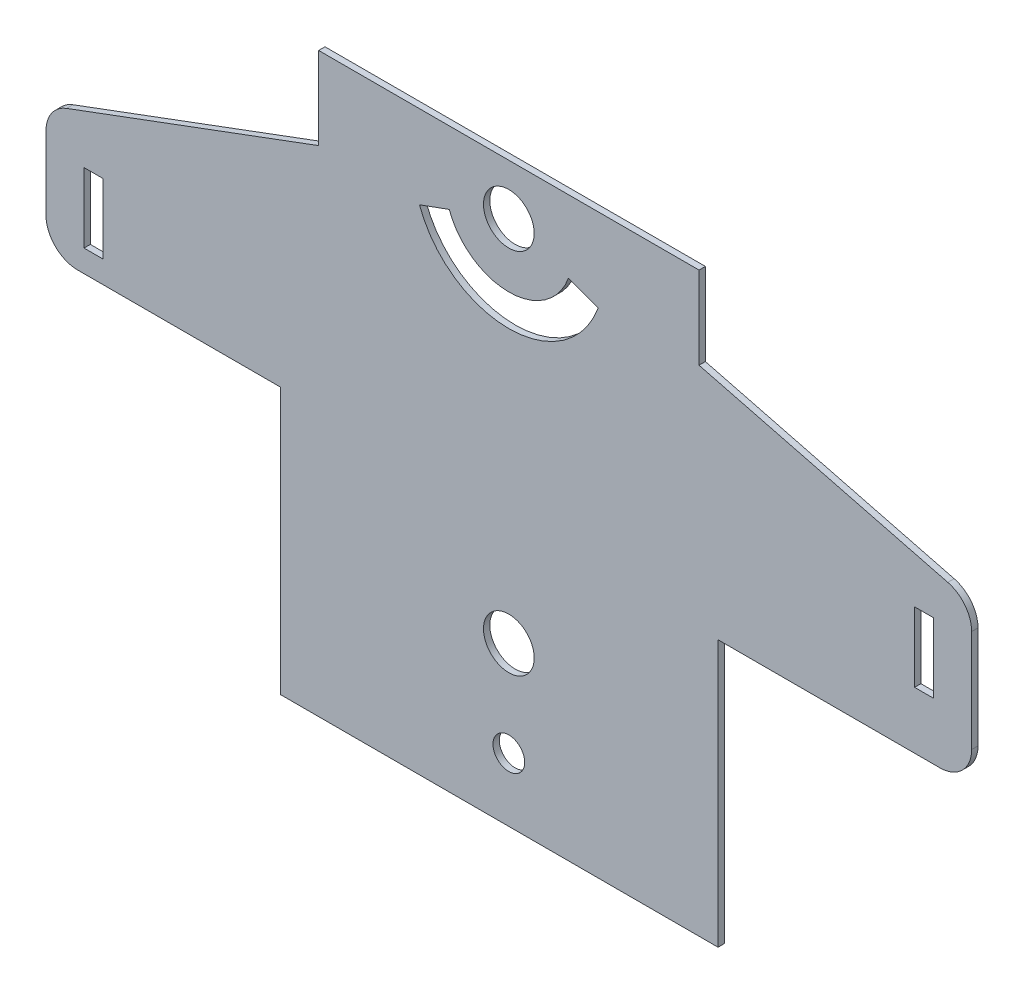
from build123d import *

# Parameters (mm, degrees)
SKETCH1_W                    = 68
SKETCH1_H                    = 42
BOSS_EXTRUDE1_DEPTH          = 1
SKETCH3_W                    = 1
SKETCH3_H                    = 42
EXTRUDE_THIN1_DEPTH          = 20
SKETCH4_R                    = 5
CUT_EXTRUDE1_DEPTH           = 144.394560566
SKETCH6_W                    = 3
SKETCH6_H                    = 11
CUT_EXTRUDE2_DEPTH           = 143.779550356
SKETCH6_3_R                  = 4
BOSS_EXTRUDE2_DEPTH          = 15
SKETCH6_4_R                  = 2.5
SKETCH6_4_R_2                = 4
BOSS_EXTRUDE3_DEPTH          = 6
SKETCH7_W                    = 1
SKETCH7_H                    = 42
BOSS_EXTRUDE5_DEPTH          = 1
FILLET2_R                    = 5
SKETCH8_W                    = 60
SKETCH8_H                    = 1
BOSS_EXTRUDE6_DEPTH          = 20
CONVERT_SOLID1_START         = -20
CONVERT_SOLID1_OUTLINE_W     = 1
CONVERT_SOLID1_OUTLINE_H     = 42
CONVERT_SOLID1_OUTLINE_W_2   = 60
CONVERT_SOLID1_OUTLINE_H_2   = 1
CONVERT_SOLID1_DEPTH         = 20
CONVERT_SOLID1_2_OUTLINE_R   = 2.5
CONVERT_SOLID1_2_OUTLINE_R_2 = 4
CONVERT_SOLID1_2_DEPTH       = 16


# Read off the part's stored shape, not the designer's step: Convert-Solid1
with BuildPart() as part:
    # Sketch1 → Boss-Extrude1 (new body)
    with BuildSketch(Plane.XY):
        Polygon((-38, 62), (-38, 42), (0, 42), (68, 42), (108, 42), (108, 67), (65, 78), (65, 91), (5, 91), (5, 78), align=None)
        with Locations((34, 21)):
            Rectangle(SKETCH1_W, SKETCH1_H)
    extrude(amount=BOSS_EXTRUDE1_DEPTH)

    # Sketch3 → Extrude-Thin1 (add)
    with BuildSketch(Plane(origin=(0, 0, 0), x_dir=(-1, 0, 0), z_dir=(0, 0, -1))):
        with Locations((0.5, 21)):
            Rectangle(SKETCH3_W, SKETCH3_H)
        with Locations((-67.5, 21)):
            Rectangle(SKETCH3_W, SKETCH3_H)
    extrude(amount=EXTRUDE_THIN1_DEPTH)


with BuildPart() as extrude_thin1_piece_1:
    # of the separate pieces the step leaves, piece 1, a body of its own (extrude_thin1_pieces)
    add(part.part.solids().sort_by_distance((-38, 62, 0))[0])


with BuildPart() as extrude_thin1_piece_2:
    # of the separate pieces the step leaves, piece 2, a body of its own (extrude_thin1_pieces)
    add(part.part.solids().sort_by_distance((0, 42, -20))[0])


with BuildPart() as cut_extrude1_tool:
    # Sketch4 → Cut-Extrude1 (new, through all)
    with BuildSketch(Plane.ZY.offset(1)):
        with Locations((-9.5, 15)):
            Circle(SKETCH4_R)
    extrude(amount=-CUT_EXTRUDE1_DEPTH)


with BuildPart() as extrude_thin1_piece_1_1:
    add(extrude_thin1_piece_1.part)

    # Cut-Extrude1: cut by cut_extrude1_tool
    add(cut_extrude1_tool.part, mode=Mode.SUBTRACT)

    # Sketch6 → Cut-Extrude2 (cut, through all)
    with BuildSketch(Plane.XY.offset(1)):
        with Locations((100.5, 56.5)):
            Rectangle(SKETCH6_W, SKETCH6_H)
        with Locations((-30.5, 51)):
            Rectangle(SKETCH6_W, SKETCH6_H)
        with BuildLine():
            Line((49.095389312, 77.86969785), (44.396926208, 79.579798567))
            ThreePointArc((44.396926208, 79.579798567), (35, 73), (25.603073792, 79.579798567))
            Line((25.603073792, 79.579798567), (20.904610688, 77.86969785))
            ThreePointArc((20.904610688, 77.86969785), (35, 68), (49.095389312, 77.86969785))
        make_face()
    extrude(amount=-CUT_EXTRUDE2_DEPTH, mode=Mode.SUBTRACT)

    # Sketch6<3> → Boss-Extrude2 (add)
    with BuildSketch(Plane.XY.offset(1)):
        with Locations((35, 83)):
            Circle(SKETCH6_3_R)
    extrude(amount=BOSS_EXTRUDE2_DEPTH)

    # Sketch6<4> → Boss-Extrude3 (add)
    with BuildSketch(Plane.XY.offset(1)):
        with Locations((35, 10)):
            Circle(SKETCH6_4_R)
        with Locations((35, 25)):
            Circle(SKETCH6_4_R_2)
    extrude(amount=BOSS_EXTRUDE3_DEPTH)



with BuildPart() as extrude_thin1_piece_2_1:
    add(extrude_thin1_piece_2.part)

    # Cut-Extrude1: cut by cut_extrude1_tool
    add(cut_extrude1_tool.part, mode=Mode.SUBTRACT)


with BuildPart() as extrude_thin1_piece_1_2:
    add(extrude_thin1_piece_1_1.part)

    add(extrude_thin1_piece_2_1.part)  # Boss-Extrude5 merges Extrude-Thin1 piece 2
    # Sketch7 → Boss-Extrude5 (add)
    with BuildSketch(Plane.XY):
        with Locations((-0.5, 21)):
            Rectangle(SKETCH7_W, SKETCH7_H)
    extrude(amount=BOSS_EXTRUDE5_DEPTH)

    # Fillet2
    fillet2_edges = [extrude_thin1_piece_1_2.edges().sort_by_distance(p)[0] for p in [
        (-0.5, 0, -20),
        (-38, 42, 0.5),
        (-38, 62, 0.5),
        (67.5, 0, -20),
        (108, 42, 0.5),
        (108, 67, 0.5),
        (67.5, 42, -20),
        (-0.5, 42, -20),
    ]]
    fillet(fillet2_edges, radius=FILLET2_R)

    # Sketch8 → Boss-Extrude6 (add)
    with BuildSketch(Plane(origin=(0, 0, 0), x_dir=(-1, 0, 0), z_dir=(0, 0, -1))):
        with Locations((-35, 90.5)):
            Rectangle(SKETCH8_W, SKETCH8_H)
    extrude(amount=BOSS_EXTRUDE6_DEPTH)

    # Convert-Solid1 outline → Convert-Solid1 (cut)
    with BuildSketch(Plane.XY.offset(CONVERT_SOLID1_START)):
        with Locations((-0.5, 21)):
            Rectangle(CONVERT_SOLID1_OUTLINE_W, CONVERT_SOLID1_OUTLINE_H)
        with Locations((67.5, 21)):
            Rectangle(CONVERT_SOLID1_OUTLINE_W, CONVERT_SOLID1_OUTLINE_H)
        with Locations((35, 90.5)):
            Rectangle(CONVERT_SOLID1_OUTLINE_W_2, CONVERT_SOLID1_OUTLINE_H_2)
    extrude(amount=CONVERT_SOLID1_DEPTH, mode=Mode.SUBTRACT)

    # Convert-Solid1 2 outline → Convert-Solid1 2 (cut)
    with BuildSketch(Plane.XY):
        with Locations((35, 10)):
            Circle(CONVERT_SOLID1_2_OUTLINE_R)
        with Locations((35, 25)):
            Circle(CONVERT_SOLID1_2_OUTLINE_R_2)
        with Locations((35, 83)):
            Circle(CONVERT_SOLID1_2_OUTLINE_R_2)
    extrude(amount=CONVERT_SOLID1_2_DEPTH, mode=Mode.SUBTRACT)


solid = extrude_thin1_piece_1_2.part
